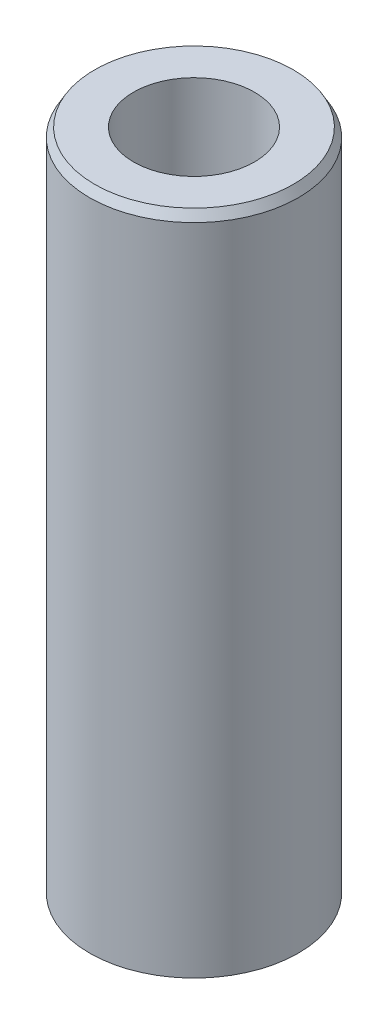
from build123d import *
from OCP.BRepFilletAPI import BRepFilletAPI_MakeChamfer

# Parameters (mm, degrees)
SKETCH1_R           = 20
BOSS_EXTRUDE1_DEPTH = 127.952762042
SKETCH2_R           = 11.585178082
CUT_EXTRUDE1_DEPTH  = 132.041631989
CHAMFER1_SIZE       = 1.709341134
CHAMFER1_SIZE2      = 0.986888564


with BuildPart() as part:
    # Sketch1 → Boss-Extrude1 (new body)
    with BuildSketch(Plane(origin=(0, 0, 0), x_dir=(1, 0, 0), z_dir=(0, 1, 0))):
        Circle(SKETCH1_R)
    extrude(amount=BOSS_EXTRUDE1_DEPTH)

    # Sketch2 → Cut-Extrude1 (cut, through all)
    with BuildSketch(Plane(origin=(0, 0, 0), x_dir=(1, 0, 0), z_dir=(0, 1, 0))):
        Circle(SKETCH2_R)
    extrude(amount=CUT_EXTRUDE1_DEPTH, mode=Mode.SUBTRACT)

    # Chamfer1: one chamfer whose edges measure the first distance from different faces: ONE call of the kernel's chamfer builder (chamfer() names one face for all edges)
    chamfer1_edges_1 = [part.edges().sort_by_distance(p)[0] for p in [
        (-20, 127.952762042, 0),
    ]]
    chamfer1_side_1 = [part.faces().sort_by_distance(p)[0] for p in [
        (-20, 63.976381021, 0),
    ]]
    chamfer1_edges_2 = [part.edges().sort_by_distance(p)[0] for p in [
        (-20, 0, 0),
    ]]
    chamfer1_side_2 = [part.faces().sort_by_distance(p)[0] for p in [
        (-19.434314575, 0, 0),
    ]]
    chamfer1 = BRepFilletAPI_MakeChamfer(part.part.solid().wrapped)
    for e in chamfer1_edges_1:
        chamfer1.Add(CHAMFER1_SIZE, CHAMFER1_SIZE2, e.wrapped, chamfer1_side_1[0].wrapped)  # the first distance lies on this face
    for e in chamfer1_edges_2:
        chamfer1.Add(CHAMFER1_SIZE, CHAMFER1_SIZE2, e.wrapped, chamfer1_side_2[0].wrapped)  # the first distance lies on this face
    add(Compound.cast(chamfer1.Shape()), mode=Mode.REPLACE)


solid = part.part
